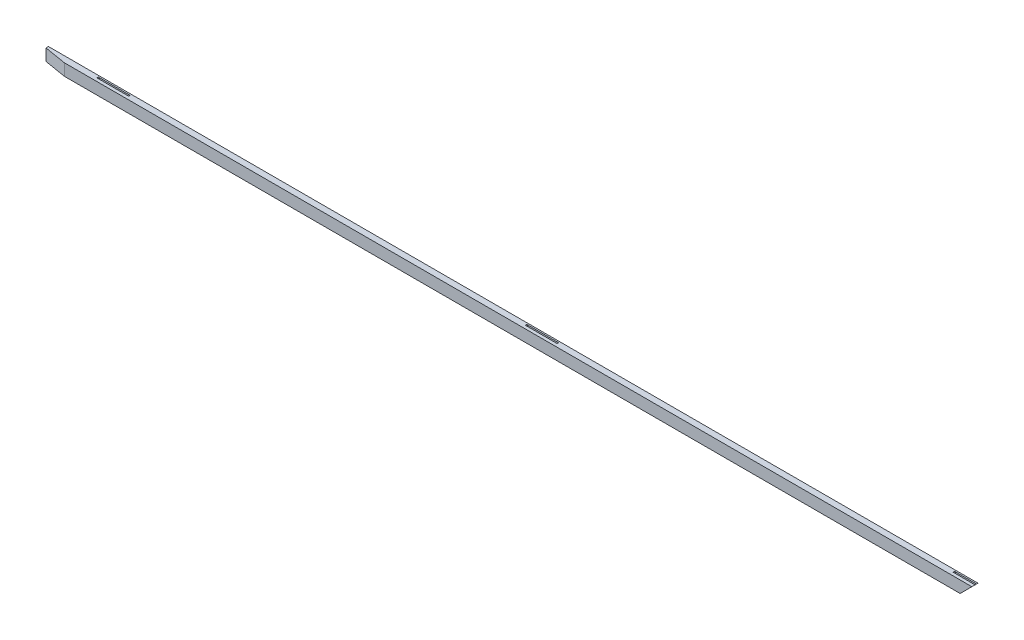
from build123d import *

# Parameters (mm, degrees)
EXTRUDE_1_DEPTH        = 25
SKETCH_2_W             = 115
SKETCH_2_H             = 6
CUT_EXTRUDE_1_DEPTH    = 7.5
DRAFT_1_ANGLE          = 45
MIRROR_START           = 6
MIRROR_1_DEPTH         = 6
PATTERN_START          = 6
PATTERN_LINEAR_1_DEPTH = 6
CUT_EXTRUDE_START      = -13
CUT_EXTRUDE_3_DEPTH    = 6
CUT_EXTRUDE_4_REACH    = 3800.386


# Read off the part's stored shape, not the designer's step: 镜向1, 阵列(线性)1
with BuildPart() as part:
    # 草图1 → 凸台-拉伸1 (new body)
    with BuildSketch(Plane.XY):
        Polygon((0, 24), (0, -24), (3750, -24), (3798, 24), align=None)
    extrude(amount=EXTRUDE_1_DEPTH)

    # 草图2 → 切除-拉伸1 (cut)
    with BuildSketch(Plane.XZ.offset(24)):
        with Locations((2025, 9)):
            Rectangle(SKETCH_2_W, SKETCH_2_H)
    extrude(amount=-CUT_EXTRUDE_1_DEPTH, mode=Mode.SUBTRACT)

    # 拔模1
    draft_1_faces = [part.faces().sort_by_distance(p)[0] for p in [
        (2082.5, -20.25, 9),
        (1967.5, -20.25, 9),
    ]]
    draft(draft_1_faces, Plane(origin=(0, -16.5, 0), x_dir=(0, 0, -1), z_dir=(0, -1, 0)), DRAFT_1_ANGLE)

    # 镜向1 outline → 镜向1 (cut)
    with BuildSketch(Plane.XY.offset(MIRROR_START)):
        Polygon((2082.5, 16.5), (2090, 24), (1960, 24), (1967.5, 16.5), align=None)
    extrude(amount=MIRROR_1_DEPTH, mode=Mode.SUBTRACT)

    # 阵列(线性)1 outline → 阵列(线性)1 (cut)
    with BuildSketch(Plane.XY.offset(PATTERN_START)):
        Polygon((332.5, 16.5), (340, 24), (210, 24), (217.5, 16.5), align=None)
        Polygon((340, -24), (332.5, -16.5), (217.5, -16.5), (210, -24), align=None)
    extrude(amount=PATTERN_LINEAR_1_DEPTH, mode=Mode.SUBTRACT)

    # 草图4 → 切除-拉伸3 (cut)
    with BuildSketch(Plane.XY.offset(25).offset(CUT_EXTRUDE_START)):
        Polygon((3708.5, 24), (3716, 16.5), (3790.5, 16.5), (3798, 24), align=None)
        Polygon((3708.5, -24), (3716, -16.5), (3757.5, -16.5), (3750, -24), align=None)
    extrude(amount=-CUT_EXTRUDE_3_DEPTH, mode=Mode.SUBTRACT)

    # 草图5 → 切除-拉伸4 (cut, up to next)
    with BuildSketch(Plane.XZ.offset(24), mode=Mode.PRIVATE) as cut_extrude_4_sk1:
        Polygon((0, 10), (90, 25), (0, 25), align=None)
    cut_extrude_4_tool1 = extrude(cut_extrude_4_sk1.sketch, amount=-CUT_EXTRUDE_4_REACH, mode=Mode.PRIVATE) & part.part
    add(cut_extrude_4_tool1.solids().sort_by_distance((30, -24, 20))[0], mode=Mode.SUBTRACT)


solid = part.part
